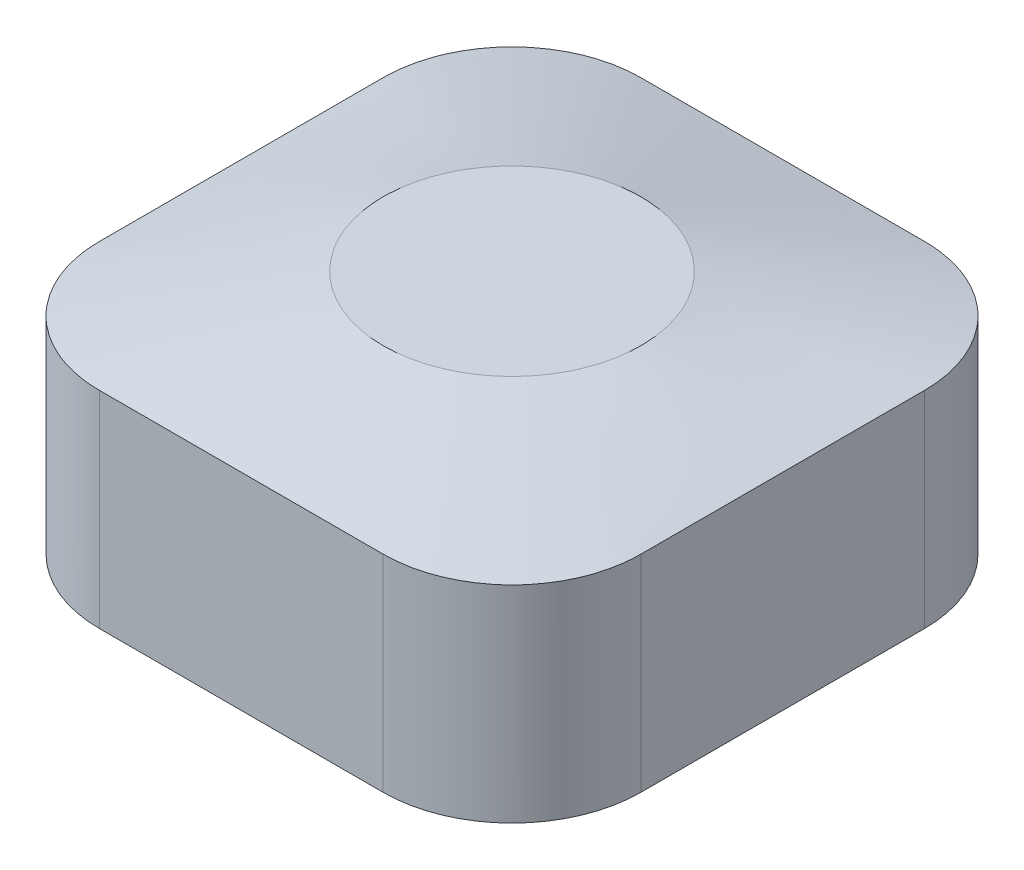
from build123d import *

# Parameters (mm, degrees)
SKETCH1_W           = 21
SKETCH1_H           = 21
BOSS_EXTRUDE1_DEPTH = 8
FILLET1_R           = 5
CUT_EXTRUDE2_DEPTH  = 6.5
SKETCH11_R          = 2.65
BOSS_EXTRUDE4_DEPTH = 3
SKETCH2_R           = 5


with BuildPart() as part:
    # Sketch1 → Boss-Extrude1 (new body)
    with BuildSketch(Plane(origin=(0, 0, 0), x_dir=(1, 0, 0), z_dir=(0, 1, 0))):
        with Locations((10.5, -10.5)):
            Rectangle(SKETCH1_W, SKETCH1_H)
    extrude(amount=BOSS_EXTRUDE1_DEPTH)

    # Fillet1
    fillet1_edges = [part.edges().sort_by_distance(p)[0] for p in [
        (0, 4, 0),
        (21, 4, 0),
        (21, 4, 21),
        (0, 4, 21),
    ]]
    fillet(fillet1_edges, radius=FILLET1_R)

    # Sketch10 → Cut-Extrude2 (cut)
    with BuildSketch(Plane.XZ):
        with BuildLine():
            Line((5, 1.5), (16, 1.5))
            ThreePointArc((16, 1.5), (18.474873734, 2.525126266), (19.5, 5))
            Line((19.5, 5), (19.5, 16))
            ThreePointArc((19.5, 16), (18.474873734, 18.474873734), (16, 19.5))
            Line((16, 19.5), (5, 19.5))
            ThreePointArc((5, 19.5), (2.525126266, 18.474873734), (1.5, 16))
            Line((1.5, 16), (1.5, 5))
            ThreePointArc((1.5, 5), (2.525126266, 2.525126266), (5, 1.5))
        make_face()
    extrude(amount=-CUT_EXTRUDE2_DEPTH, mode=Mode.SUBTRACT)

    # Sketch11 → Boss-Extrude4 (add)
    with BuildSketch(Plane.XZ.offset(-6.5)):
        with Locations(Location((10.5, 10.5, 0), (0, 0, 90))):
            Circle(SKETCH11_R)
    extrude(amount=BOSS_EXTRUDE4_DEPTH)

    # Sketch3 → Loft2 section 0
    with BuildSketch(Plane(origin=(0, 8, 0), x_dir=(1, 0, 0), z_dir=(0, 1, 0))):
        with BuildLine():
            Line((16, 0), (5, 0))
            ThreePointArc((5, 0), (1.464466094, -1.464466094), (0, -5))
            Line((0, -5), (0, -16))
            ThreePointArc((0, -16), (1.464466094, -19.535533906), (5, -21))
            Line((5, -21), (16, -21))
            ThreePointArc((16, -21), (19.535533906, -19.535533906), (21, -16))
            Line((21, -16), (21, -5))
            ThreePointArc((21, -5), (19.535533906, -1.464466094), (16, 0))
        make_face()
    # Sketch2 → Loft2 section 1
    with BuildSketch(Plane(origin=(0, 9.5, 0), x_dir=(1, 0, 0), z_dir=(0, 1, 0))):
        with Locations((10.5, -10.5)):
            Circle(SKETCH2_R)
    loft()


solid = part.part
